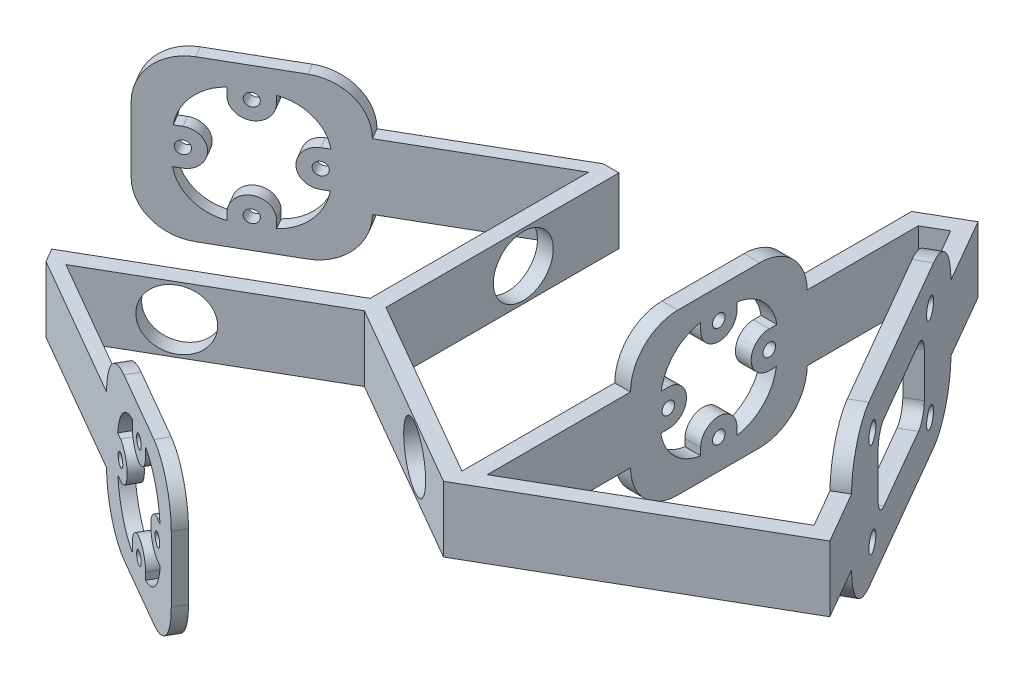
from build123d import *

# Parameters (mm, degrees)
BOSS_EXTRUDE1_DEPTH = 50.8
SKETCH3_R           = 9.5
CUT_EXTRUDE2_DEPTH  = 38.1
BOSS_EXTRUDE2_DEPTH = 50.8
CIRPATTERN1_COUNT   = 3
SKETCH6_R           = 2
CUT_EXTRUDE3_DEPTH  = 4
CIRPATTERN2_COUNT   = 2
CIRPATTERN2_ANGLE   = 240
BOSS_EXTRUDE4_DEPTH = 50.8
SKETCH8_R           = 2
CUT_EXTRUDE8_DEPTH  = 12.7
SKETCH9_R           = 3
SKETCH9_W           = 40
SKETCH9_H           = 24
CUT_EXTRUDE9_DEPTH  = 15
CUT_EXTRUDE10_START = -50.8
CUT_EXTRUDE10_DEPTH = 50.8
SKETCH15_W          = 56.837168574
SKETCH15_H          = 15
CUT_EXTRUDE15_DEPTH = 69
CIRPATTERN3_COUNT   = 3
SKETCH13_W          = 89.665063509
SKETCH13_H          = 15
CUT_EXTRUDE13_DEPTH = 18.871778265
CUT_EXTRUDE14_DEPTH = 15
CUT_EXTRUDE16_START = -15
SKETCH16_W          = 5
SKETCH16_H          = 45.430780618
CUT_EXTRUDE16_DEPTH = 15
FILLET2_R           = 15
FILLET3_R           = 5


with BuildPart() as part:
    # Sketch1 → Boss-Extrude1 (new body)
    with BuildSketch(Plane(origin=(0, 0, 0), x_dir=(1, 0, 0), z_dir=(0, 1, 0))):
        Polygon((-2.5, 1.443375673), (-2.5, 70), (2.5, 70), (2.5, 1.443375673), (61.871778265, -32.834936491), (59.371778265, -37.165063509), (0, -2.886751346), (-59.371778265, -37.165063509), (-61.871778265, -32.834936491), align=None)
    extrude(amount=BOSS_EXTRUDE1_DEPTH)

    # Sketch3 → Cut-Extrude2 (cut)
    with BuildSketch(Plane(origin=(1.25, 0, -2.165063509), x_dir=(0.866025403784426, 0, 0.5000000000000221), z_dir=(-0.5000000000000221, 0, 0.866025403784426))):
        with Locations(Location((45, 25.4, 0), (0, 0, 180))):
            Circle(SKETCH3_R)
    cut_extrude2 = extrude(amount=CUT_EXTRUDE2_DEPTH, mode=Mode.SUBTRACT)

    # Sketch4 → Boss-Extrude2 (add)
    with BuildSketch(Plane(origin=(0, 50.8, 0), x_dir=(1, 0, 0), z_dir=(0, 1, 0))):
        Polygon((-2.5, 75.344210129), (-96.469854476, 21.090689352), (-94.469854476, 17.626587737), (-2.5, 70.725407976), (-2.5, 65), (2.5, 65), (2.5, 75.344210129), align=None)
    boss_extrude2 = extrude(amount=-BOSS_EXTRUDE2_DEPTH)

    # CirPattern1: Cut-Extrude2 ×3 about axis
    cirpattern1_axis = Axis((0, 40.005, 0), (0, -1, 0))
    for i in range(1, CIRPATTERN1_COUNT):
        add(cut_extrude2.rotate(cirpattern1_axis, i * 360 / CIRPATTERN1_COUNT), mode=Mode.SUBTRACT)

    # Sketch6 → Cut-Extrude3 (cut)
    with BuildSketch(Plane(origin=(-33.25, 0, -57.590689352), x_dir=(0.8660254037844385, 0, -0.5000000000000003), z_dir=(0.5000000000000003, 0, 0.8660254037844385))):
        with Locations((-45, 41.4)):
            Circle(SKETCH6_R)
        with Locations((-29, 25.4)):
            Circle(SKETCH6_R)
        with Locations((-45, 9.4)):
            Circle(SKETCH6_R)
        with Locations((-61, 25.4)):
            Circle(SKETCH6_R)
        with BuildLine():
            Line((-50.75, 41.4), (-50.75, 43.8))
            Line((-50.75, 43.8), (-63.4, 43.8))
            Line((-63.4, 43.8), (-63.4, 31.15))
            Line((-63.4, 31.15), (-61, 31.15))
            ThreePointArc((-61, 31.15), (-55.25, 25.4), (-61, 19.65))
            Line((-61, 19.65), (-63.4, 19.65))
            Line((-63.4, 19.65), (-63.4, 7))
            Line((-63.4, 7), (-50.75, 7))
            Line((-50.75, 7), (-50.75, 9.4))
            ThreePointArc((-50.75, 9.4), (-45, 15.15), (-39.25, 9.4))
            Line((-39.25, 9.4), (-39.25, 7))
            Line((-39.25, 7), (-26.6, 7))
            Line((-26.6, 7), (-26.6, 19.65))
            Line((-26.6, 19.65), (-29, 19.65))
            ThreePointArc((-29, 19.65), (-34.75, 25.4), (-29, 31.15))
            Line((-29, 31.15), (-26.6, 31.15))
            Line((-26.6, 31.15), (-26.6, 43.8))
            Line((-26.6, 43.8), (-39.25, 43.8))
            Line((-39.25, 43.8), (-39.25, 41.4))
            ThreePointArc((-39.25, 41.4), (-45, 35.65), (-50.75, 41.4))
        make_face()
    cut_extrude3 = extrude(amount=CUT_EXTRUDE3_DEPTH, mode=Mode.SUBTRACT)

    # CirPattern2: Boss-Extrude2, Cut-Extrude3 ×2 about axis
    cirpattern2_axis = Axis((0, 0, 0), (0, -1, 0))
    add([boss_extrude2.rotate(cirpattern2_axis, i * CIRPATTERN2_ANGLE / (CIRPATTERN2_COUNT - 1)) for i in range(1, CIRPATTERN2_COUNT)])
    add([cut_extrude3.rotate(cirpattern2_axis, i * CIRPATTERN2_ANGLE / (CIRPATTERN2_COUNT - 1)) for i in range(1, CIRPATTERN2_COUNT)], mode=Mode.SUBTRACT)

    # Sketch5 → Boss-Extrude4 (add)
    with BuildSketch(Plane(origin=(0, 50.8, 0), x_dir=(1, 0, 0), z_dir=(0, 1, 0))):
        Polygon((59.5, -31.465589671), (59.371778265, -37.165063509), (137.024001096, 7.667468245), (72.838111964, 118.840689352), (59.5, 111.139926819), align=None)
    extrude(amount=-BOSS_EXTRUDE4_DEPTH)

    # Sketch8 → Cut-Extrude8 (cut)
    with BuildSketch(Plane(origin=(59.5, 0, 0), x_dir=(0, 0, -1), z_dir=(1, 0, 0))):
        with Locations((45, 41.4)):
            Circle(SKETCH8_R)
        with Locations((61, 25.4)):
            Circle(SKETCH8_R)
        with Locations((45, 9.4)):
            Circle(SKETCH8_R)
        with Locations((29, 25.4)):
            Circle(SKETCH8_R)
        with BuildLine():
            Line((39.25, 41.4), (39.25, 43.8))
            Line((39.25, 43.8), (26.6, 43.8))
            Line((26.6, 43.8), (26.6, 31.15))
            Line((26.6, 31.15), (29, 31.15))
            ThreePointArc((29, 31.15), (34.75, 25.4), (29, 19.65))
            Line((29, 19.65), (26.6, 19.65))
            Line((26.6, 19.65), (26.6, 7))
            Line((26.6, 7), (39.25, 7))
            Line((39.25, 7), (39.25, 9.4))
            ThreePointArc((39.25, 9.4), (45, 15.15), (50.75, 9.4))
            Line((50.75, 9.4), (50.75, 7))
            Line((50.75, 7), (63.4, 7))
            Line((63.4, 7), (63.4, 19.65))
            Line((63.4, 19.65), (61, 19.65))
            ThreePointArc((61, 19.65), (55.25, 25.4), (61, 31.15))
            Line((61, 31.15), (63.4, 31.15))
            Line((63.4, 31.15), (63.4, 43.8))
            Line((63.4, 43.8), (50.75, 43.8))
            Line((50.75, 43.8), (50.75, 41.4))
            ThreePointArc((50.75, 41.4), (45, 35.65), (39.25, 41.4))
        make_face()
    extrude(amount=CUT_EXTRUDE8_DEPTH, mode=Mode.SUBTRACT)

    # Sketch9 → Cut-Extrude9 (cut)
    with BuildSketch(Plane(origin=(106.088111964, 0, -61.25), x_dir=(-0.49999999999999906, 0, -0.8660254037844392), z_dir=(0.8660254037844392, 0, -0.49999999999999906))):
        with Locations((-25, 40.4)):
            Circle(SKETCH9_R)
        with Locations((25, 40.4)):
            Circle(SKETCH9_R)
        with Locations((25, 10.4)):
            Circle(SKETCH9_R)
        with Locations((-25, 10.4)):
            Circle(SKETCH9_R)
        with Locations((0, 25.4)):
            Rectangle(SKETCH9_W, SKETCH9_H)
    extrude(amount=-CUT_EXTRUDE9_DEPTH, mode=Mode.SUBTRACT)

    # Sketch10 → Cut-Extrude10 (cut)
    with BuildSketch(Plane(origin=(0, 50.8, 0), x_dir=(1, 0, 0), z_dir=(0, 1, 0)).offset(CUT_EXTRUDE10_START)):
        Polygon((71.007984945, 112.010562333), (64.5, 108.253175473), (64.5, -28.430780618), (130.193874077, 9.497595264), align=None)
    extrude(amount=CUT_EXTRUDE10_DEPTH, mode=Mode.SUBTRACT)

    # Sketch15 → Cut-Extrude15 (cut)
    with BuildSketch(Plane(origin=(-33.25, 0, 57.590689352), x_dir=(0.866025403784434, 0, 0.5000000000000081), z_dir=(-0.5000000000000081, 0, 0.866025403784434))):
        with Locations((-11.418584287, 7.5)):
            Rectangle(SKETCH15_W, SKETCH15_H)
    cut_extrude15 = extrude(amount=-CUT_EXTRUDE15_DEPTH, mode=Mode.SUBTRACT)

    # CirPattern3: Cut-Extrude15 ×3 about axis
    cirpattern3_axis = Axis((0, 0, 0), (0, 1, 0))
    for i in range(1, CIRPATTERN3_COUNT):
        add(cut_extrude15.rotate(cirpattern3_axis, i * 360 / CIRPATTERN3_COUNT), mode=Mode.SUBTRACT)

    # Sketch13 → Cut-Extrude13 (cut)
    with BuildSketch(Plane(origin=(30.935889132, 0, 53.582531755), x_dir=(0.8660254037844389, 0, -0.4999999999999997), z_dir=(0.4999999999999997, 0, 0.8660254037844389))):
        with Locations((77.667468246, 7.5)):
            Rectangle(SKETCH13_W, SKETCH13_H)
    extrude(amount=-CUT_EXTRUDE13_DEPTH, mode=Mode.SUBTRACT)

    # Sketch14 → Cut-Extrude14 (cut)
    with BuildSketch(Plane(origin=(0, 50.8, 0), x_dir=(1, 0, 0), z_dir=(0, 1, 0))):
        Polygon((2.5, 75.344210129), (2.5, 1.443375673), (59.5, -31.465589671), (59.5, 17), (64.5, 17), (64.5, -28.430780618), (130.193874077, 9.497595264), (123.257984945, 21.510907637), (127.588111964, 24.010907637), (137.024001096, 7.667468245), (59.371778265, -37.165063509), (0, -2.886751346), (-60, -37.527767497), (-16.527568136, -62.626587737), (-18.527568136, -66.090689352), (-64, -39.837168574), (-66.5, -35.507041555), (-2.5, 1.443375673), (-2.5, 70.725407976), (-45.972431864, 45.626587737), (-47.972431864, 49.090689352), (-2.5, 75.344210129), align=None)
        Polygon((59.5, 73), (64.5, 73), (64.5, 108.253175473), (71.007984945, 112.010562333), (80.257984945, 95.989092363), (84.588111964, 98.489092363), (72.838111964, 118.840689352), (59.5, 111.139926819), align=None)
    extrude(amount=-CUT_EXTRUDE14_DEPTH, mode=Mode.SUBTRACT)

    # Sketch16 → Cut-Extrude16 (cut)
    with BuildSketch(Plane.XZ.offset(CUT_EXTRUDE16_START)):
        Polygon((59.5, -73), (64.5, -73), (64.5, -108.253175473), (71.007984945, -112.010562333), (80.257984945, -95.989092363), (84.588111964, -98.489092363), (72.838111964, -118.840689352), (59.5, -111.139926819), align=None)
        with Locations((62, 5.715390309)):
            Rectangle(SKETCH16_W, SKETCH16_H)
    extrude(amount=CUT_EXTRUDE16_DEPTH, mode=Mode.SUBTRACT)

    # Fillet2
    # the kernel refuses this fillet: 15 mm, written as the material it adds along each edge
    with BuildSketch(Plane(origin=(-88.1560106, 43.8, -25.890689352), x_dir=(0, -1, 0), z_dir=(0.5000000000000003, 0, 0.8660254037844385)), Plane(origin=(-88.1560106, 7, -25.890689352), x_dir=(0.8660254037844385, 0, -0.5000000000000003), z_dir=(0.5000000000000003, 0, 0.8660254037844385)), Plane(origin=(21.6560106, 43.8, 89.290689352), x_dir=(0, -1, 0), z_dir=(0.5000000000000085, 0, -0.8660254037844338)), Plane(origin=(21.6560106, 7, 89.290689352), x_dir=(-0.8660254037844338, 0, -0.5000000000000085), z_dir=(0.5000000000000085, 0, -0.8660254037844338))) as fillet2_piece_1:
        with BuildLine():
            CenterArc((14.814773032, 15), FILLET2_R, 189.013470262, 80.986529738)
            Line((0, 12.65), (0, 0))
            Line((0, 0), (14.814773032, 0))
        make_face()
    extrude(amount=4)
    with BuildSketch(Plane(origin=(-56.286275741, 7, -44.290689352), x_dir=(-0.8660254037844385, 4.893757774948481e-14, 0.5000000000000003), z_dir=(0.5000000000000003, 0, 0.8660254037844385)), Plane(origin=(-56.286275741, 43.8, -44.290689352), x_dir=(0, -1, 0), z_dir=(0.5000000000000003, 0, 0.8660254037844385)), Plane(origin=(-10.213724259, 7, 70.890689352), x_dir=(0.8660254037844337, 4.7252496162702025e-14, 0.5000000000000085), z_dir=(0.5000000000000085, 0, -0.8660254037844338)), Plane(origin=(-10.213724259, 43.8, 70.890689352), x_dir=(0, -1, 0), z_dir=(0.5000000000000085, 0, -0.8660254037844338))) as fillet2_piece_2:
        with BuildLine():
            CenterArc((15, -14.814773032), FILLET2_R, 99.013470262, 80.986529738)
            Line((0, -14.814773032), (0, 0))
            Line((0, 0), (12.65, 0))
        make_face()
    extrude(amount=4)
    with BuildSketch(Plane(origin=(59.5, 43.8, -63.4), x_dir=(0, -1, 0), z_dir=(1, 0, 0)), Plane(origin=(59.5, 7, -63.4), x_dir=(0, 0, 1), z_dir=(1, 0, 0))) as fillet2_piece_3:
        with BuildLine():
            CenterArc((15, -14.814773032), FILLET2_R, 99.013470262, 80.986529738)
            Line((0, -14.814773032), (0, 0))
            Line((0, 0), (12.65, 0))
        make_face()
    extrude(amount=5)
    with BuildSketch(Plane(origin=(59.5, 7, -26.6), x_dir=(0, 0, -1), z_dir=(1, 0, 0)), Plane(origin=(59.5, 43.8, -26.6), x_dir=(0, -1, 0), z_dir=(1, 0, 0))) as fillet2_piece_4:
        with BuildLine():
            CenterArc((14.814773032, 15), FILLET2_R, 189.013470262, 80.986529738)
            Line((0, 12.65), (0, 0))
            Line((0, 0), (14.814773032, 0))
        make_face()
    extrude(amount=5)
    # the kernel refuses this fillet: 15 mm, written as the material it takes off along each edge
    with BuildSketch(Plane(origin=(11.219854476, 50.8, 126.566641994), x_dir=(-0.8660254037844358, 0, -0.500000000000005), z_dir=(0.500000000000005, 0, -0.8660254037844358)), Plane(origin=(11.219854476, 0, 126.566641994), x_dir=(0, 1, 0), z_dir=(0.500000000000005, 0, -0.8660254037844358)), Plane(origin=(-115.219854476, 50.8, -53.566641994), x_dir=(0.8660254037844364, 0, -0.5000000000000039), z_dir=(0.500000000000004, 0, 0.8660254037844364)), Plane(origin=(-115.219854476, 0, -53.566641994), x_dir=(0, 1, 0), z_dir=(0.500000000000004, 0, 0.8660254037844364)), Plane(origin=(-66.722431864, 0, -81.566641994), x_dir=(-0.8660254037844436, 0, 0.4999999999999915), z_dir=(0.4999999999999915, 0, 0.8660254037844436)), Plane(origin=(-27.222431864, 50.8, -13.150635095), x_dir=(-0.8660254037844379, 0, 0.5000000000000013), z_dir=(-0.5000000000000013, 0, -0.8660254037844379))) as fillet2_2_piece_1:
        with BuildLine():
            CenterArc((FILLET2_R, -FILLET2_R), FILLET2_R, 90, 90)
            Line((0, -FILLET2_R), (0, 0))
            Line((0, 0), (FILLET2_R, 0))
        make_face()
    extrude(amount=79, mode=Mode.SUBTRACT)
    with BuildSketch(Plane(origin=(-37.277568136, 0, 98.566641994), x_dir=(0, 1, 0), z_dir=(0.5000000000000081, 0, -0.866025403784434)), Plane(origin=(2.222431864, 50.8, 30.150635095), x_dir=(0, -1, 0), z_dir=(-0.5000000000000082, 0, 0.866025403784434))) as fillet2_2_piece_2:
        with BuildLine():
            CenterArc((FILLET2_R, FILLET2_R), FILLET2_R, 180, 90)
            Line((0, FILLET2_R), (0, 0))
            Line((0, 0), (FILLET2_R, 0))
        make_face()
    extrude(amount=79, mode=Mode.SUBTRACT)
    with BuildSketch(Plane(origin=(102, 0, -17), x_dir=(0, 1, 0), z_dir=(-1, 0, 0)), Plane(origin=(160.064064605, 0, -42.760907637), x_dir=(0, 1, 0), z_dir=(-0.8660254037844389, 0, 0.4999999999999997)), Plane(origin=(90.782032303, 50.8, -2.760907637), x_dir=(0, -1, 0), z_dir=(0.8660254037844392, 0, -0.4999999999999993)), Plane(origin=(22, 50.8, -17), x_dir=(0, -1, 0), z_dir=(1, 0, 0))) as fillet2_2_piece_3:
        with BuildLine():
            CenterArc((FILLET2_R, FILLET2_R), FILLET2_R, 180, 90)
            Line((0, FILLET2_R), (0, 0))
            Line((0, 0), (FILLET2_R, 0))
        make_face()
    extrude(amount=80, mode=Mode.SUBTRACT)
    with BuildSketch(Plane(origin=(22, 50.8, -73), x_dir=(0, 0, 1), z_dir=(1, 0, 0))) as fillet2_2_piece_4_section:
        with BuildLine():
            CenterArc((FILLET2_R, FILLET2_R), FILLET2_R, 180, 90)
            Line((0, FILLET2_R), (0, 0))
            Line((0, 0), (FILLET2_R, 0))
        make_face()
    fillet2_2_piece_4 = extrude(amount=80, mode=Mode.PRIVATE)
    fillet2_2_piece_4 = split(fillet2_2_piece_4, bisect_by=Plane(origin=(75.648057707, 50.8, -103.973720558), z_dir=(-0.8660254037844385, 0, 0.5000000000000002)), keep=Keep.TOP, mode=Mode.PRIVATE)
    add(fillet2_2_piece_4, mode=Mode.SUBTRACT)
    with BuildSketch(Plane(origin=(47.782032303, 50.8, -77.239092363), x_dir=(0, -1, 0), z_dir=(0.8660254037844397, 0, -0.4999999999999984)), Plane(origin=(47.782032303, 0, -77.239092363), x_dir=(0.49999999999999833, 0, 0.8660254037844396), z_dir=(0.8660254037844397, 0, -0.4999999999999984))) as fillet2_2_piece_5:
        with BuildLine():
            CenterArc((FILLET2_R, -FILLET2_R), FILLET2_R, 90, 90)
            Line((0, -FILLET2_R), (0, 0))
            Line((0, 0), (FILLET2_R, 0))
        make_face()
    extrude(amount=80, mode=Mode.SUBTRACT)
    with BuildSketch(Plane(origin=(22, 0, -73), x_dir=(0, 1, 0), z_dir=(1, 0, 0))) as fillet2_2_piece_6_section:
        with BuildLine():
            CenterArc((FILLET2_R, FILLET2_R), FILLET2_R, 180, 90)
            Line((0, FILLET2_R), (0, 0))
            Line((0, 0), (FILLET2_R, 0))
        make_face()
    fillet2_2_piece_6 = extrude(amount=80, mode=Mode.PRIVATE)
    fillet2_2_piece_6 = split(fillet2_2_piece_6, bisect_by=Plane(origin=(75.648057707, 0, -103.973720558), z_dir=(-0.8660254037844385, 0, 0.5000000000000002)), keep=Keep.TOP, mode=Mode.PRIVATE)
    add(fillet2_2_piece_6, mode=Mode.SUBTRACT)

    # Fillet3
    fillet3_edges = [part.edges().sort_by_distance(p)[0] for p in [
        (93.923048454, 13.4, -77.320508076),
        (113.923048454, 13.4, -42.679491924),
        (93.923048454, 37.4, -77.320508076),
        (113.923048454, 37.4, -42.679491924),
    ]]
    fillet(fillet3_edges, radius=FILLET3_R)


solid = part.part
